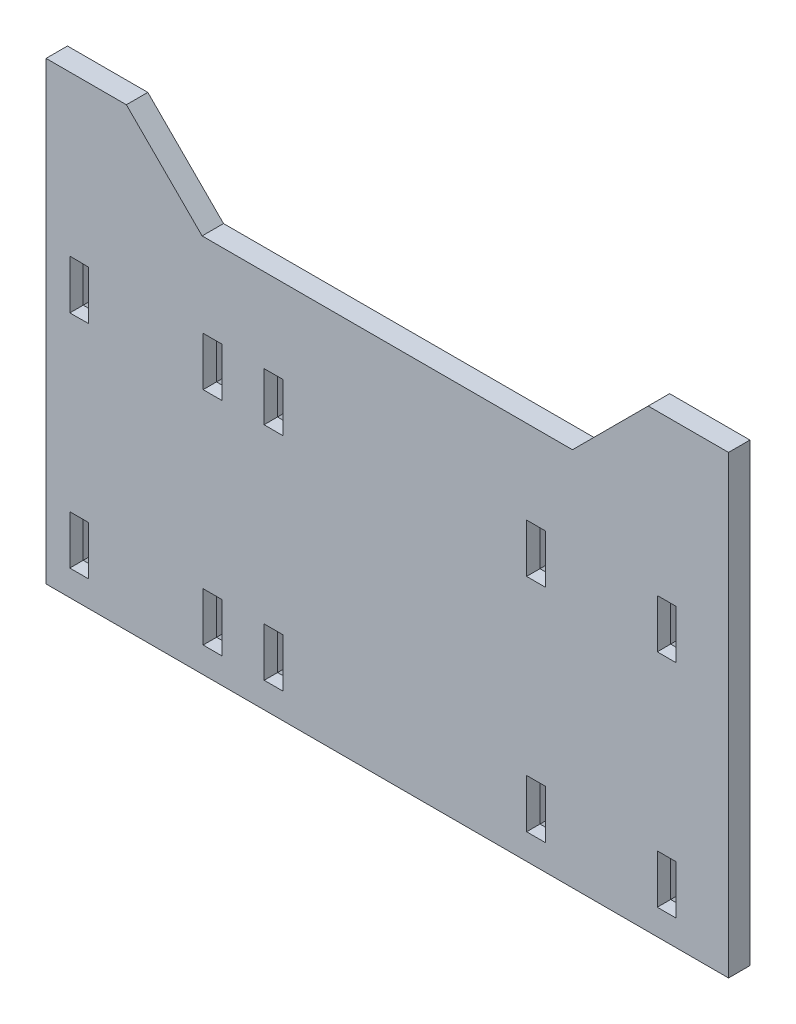
from build123d import *
from OCP.BRepFilletAPI import BRepFilletAPI_MakeChamfer

# Parameters (mm, degrees)
SKETCH1_W           = 127.440194606
SKETCH1_H           = 60
SKETCH1_W_2         = 3.53
SKETCH1_H_2         = 9.11399265
BOSS_EXTRUDE1_DEPTH = 4
BOSS_EXTRUDE2_DEPTH = 4
CHAMFER1_SIZE       = 1.5
CHAMFER1_SIZE2      = 0.5


with BuildPart() as part:
    # Sketch1 → Boss-Extrude1 (new body)
    with BuildSketch(Plane.XY):
        Rectangle(SKETCH1_W, SKETCH1_H)
        with Locations((-32.620097303, 20.65)):
            Rectangle(SKETCH1_W_2, SKETCH1_H_2, mode=Mode.SUBTRACT)
        with Locations((27.7799027, 20.65)):
            Rectangle(SKETCH1_W_2, SKETCH1_H_2, mode=Mode.SUBTRACT)
        with Locations((27.7799027, -20.65)):
            Rectangle(SKETCH1_W_2, SKETCH1_H_2, mode=Mode.SUBTRACT)
        Polygon((-19.455133439, 25.206990566), (-22.985061166, 25.184401952), (-22.999551776, 16.115598048), (-19.440642829, 16.093009434), align=None, mode=Mode.SUBTRACT)
        with Locations((-21.220097303, -20.65)):
            Rectangle(SKETCH1_W_2, SKETCH1_H_2, mode=Mode.SUBTRACT)
        with Locations((52.1799027, 20.65)):
            Rectangle(SKETCH1_W_2, SKETCH1_H_2, mode=Mode.SUBTRACT)
        with Locations((52.1799027, -20.65)):
            Rectangle(SKETCH1_W_2, SKETCH1_H_2, mode=Mode.SUBTRACT)
        with Locations((-32.620097303, -20.65)):
            Rectangle(SKETCH1_W_2, SKETCH1_H_2, mode=Mode.SUBTRACT)
        Polygon((-59.284966326, 25.25), (-55.755228279, 25.206996325), (-55.755228279, 16.093003675), (-59.284966326, 16.05), align=None, mode=Mode.SUBTRACT)
        with Locations((-57.520097303, -20.65)):
            Rectangle(SKETCH1_W_2, SKETCH1_H_2, mode=Mode.SUBTRACT)
    extrude(amount=-BOSS_EXTRUDE1_DEPTH)

    # Sketch2 → Boss-Extrude2 (add)
    with BuildSketch(Plane.XY):
        Polygon((-63.720097303, 30), (-63.720097303, 55), (-48.720097303, 55), (-34.577961679, 40.857864376), (34.577961679, 40.857864376), (48.720097303, 55), (63.720097303, 55), (63.720097303, 30), align=None)
    extrude(amount=-BOSS_EXTRUDE2_DEPTH)

    # Chamfer1: one chamfer whose edges measure the first distance from different faces: ONE call of the kernel's chamfer builder (chamfer() names one face for all edges)
    chamfer1_edges_1 = [part.edges().sort_by_distance(p)[0] for p in [
        (27.7799027, 16.093003675, -4),
    ]]
    chamfer1_side_1 = [part.faces().sort_by_distance(p)[0] for p in [
        (27.7799027, 16.093003675, -2),
    ]]
    chamfer1_edges_2 = [part.edges().sort_by_distance(p)[0] for p in [
        (29.5449027, 20.65, -4),
    ]]
    chamfer1_side_2 = [part.faces().sort_by_distance(p)[0] for p in [
        (29.5449027, 20.65, -2),
    ]]
    chamfer1_edges_3 = [part.edges().sort_by_distance(p)[0] for p in [
        (26.0149027, 20.65, -4),
    ]]
    chamfer1_side_3 = [part.faces().sort_by_distance(p)[0] for p in [
        (26.0149027, 20.65, -2),
    ]]
    chamfer1_edges_4 = [part.edges().sort_by_distance(p)[0] for p in [
        (27.7799027, 25.206996325, -4),
    ]]
    chamfer1_side_4 = [part.faces().sort_by_distance(p)[0] for p in [
        (27.7799027, 25.206996325, -2),
    ]]
    chamfer1_edges_5 = [part.edges().sort_by_distance(p)[0] for p in [
        (53.9449027, 20.65, -4),
    ]]
    chamfer1_side_5 = [part.faces().sort_by_distance(p)[0] for p in [
        (53.9449027, 20.65, -2),
    ]]
    chamfer1_edges_6 = [part.edges().sort_by_distance(p)[0] for p in [
        (52.1799027, 16.093003675, -4),
    ]]
    chamfer1_side_6 = [part.faces().sort_by_distance(p)[0] for p in [
        (52.1799027, 16.093003675, -2),
    ]]
    chamfer1_edges_7 = [part.edges().sort_by_distance(p)[0] for p in [
        (50.4149027, 20.65, -4),
    ]]
    chamfer1_side_7 = [part.faces().sort_by_distance(p)[0] for p in [
        (50.4149027, 20.65, -2),
    ]]
    chamfer1_edges_8 = [part.edges().sort_by_distance(p)[0] for p in [
        (52.1799027, 25.206996325, -4),
    ]]
    chamfer1_side_8 = [part.faces().sort_by_distance(p)[0] for p in [
        (52.1799027, 25.206996325, -2),
    ]]
    chamfer1_edges_9 = [part.edges().sort_by_distance(p)[0] for p in [
        (52.1799027, -25.206996325, -4),
    ]]
    chamfer1_side_9 = [part.faces().sort_by_distance(p)[0] for p in [
        (52.1799027, -25.206996325, -2),
    ]]
    chamfer1_edges_10 = [part.edges().sort_by_distance(p)[0] for p in [
        (53.9449027, -20.65, -4),
    ]]
    chamfer1_side_10 = [part.faces().sort_by_distance(p)[0] for p in [
        (53.9449027, -20.65, -2),
    ]]
    chamfer1_edges_11 = [part.edges().sort_by_distance(p)[0] for p in [
        (52.1799027, -16.093003675, -4),
    ]]
    chamfer1_side_11 = [part.faces().sort_by_distance(p)[0] for p in [
        (52.1799027, -16.093003675, -2),
    ]]
    chamfer1_edges_12 = [part.edges().sort_by_distance(p)[0] for p in [
        (50.4149027, -20.65, -4),
    ]]
    chamfer1_side_12 = [part.faces().sort_by_distance(p)[0] for p in [
        (50.4149027, -20.65, -2),
    ]]
    chamfer1_edges_13 = [part.edges().sort_by_distance(p)[0] for p in [
        (29.5449027, -20.65, -4),
    ]]
    chamfer1_side_13 = [part.faces().sort_by_distance(p)[0] for p in [
        (29.5449027, -20.65, -2),
    ]]
    chamfer1_edges_14 = [part.edges().sort_by_distance(p)[0] for p in [
        (27.7799027, -25.206996325, -4),
    ]]
    chamfer1_side_14 = [part.faces().sort_by_distance(p)[0] for p in [
        (27.7799027, -25.206996325, -2),
    ]]
    chamfer1_edges_15 = [part.edges().sort_by_distance(p)[0] for p in [
        (26.0149027, -20.65, -4),
    ]]
    chamfer1_side_15 = [part.faces().sort_by_distance(p)[0] for p in [
        (26.0149027, -20.65, -2),
    ]]
    chamfer1_edges_16 = [part.edges().sort_by_distance(p)[0] for p in [
        (27.7799027, -16.093003675, -4),
    ]]
    chamfer1_side_16 = [part.faces().sort_by_distance(p)[0] for p in [
        (27.7799027, -16.093003675, -2),
    ]]
    chamfer1_edges_17 = [part.edges().sort_by_distance(p)[0] for p in [
        (-21.220097303, -25.206996325, -4),
    ]]
    chamfer1_side_17 = [part.faces().sort_by_distance(p)[0] for p in [
        (-21.220097303, -25.206996325, -2),
    ]]
    chamfer1_edges_18 = [part.edges().sort_by_distance(p)[0] for p in [
        (-19.455097303, -20.65, -4),
    ]]
    chamfer1_side_18 = [part.faces().sort_by_distance(p)[0] for p in [
        (-19.455097303, -20.65, -2),
    ]]
    chamfer1_edges_19 = [part.edges().sort_by_distance(p)[0] for p in [
        (-21.220097303, -16.093003675, -4),
    ]]
    chamfer1_side_19 = [part.faces().sort_by_distance(p)[0] for p in [
        (-21.220097303, -16.093003675, -2),
    ]]
    chamfer1_edges_20 = [part.edges().sort_by_distance(p)[0] for p in [
        (-22.985097303, -20.65, -4),
    ]]
    chamfer1_side_20 = [part.faces().sort_by_distance(p)[0] for p in [
        (-22.985097303, -20.65, -2),
    ]]
    chamfer1_edges_21 = [part.edges().sort_by_distance(p)[0] for p in [
        (-30.855097303, -20.65, -4),
    ]]
    chamfer1_side_21 = [part.faces().sort_by_distance(p)[0] for p in [
        (-30.855097303, -20.65, -2),
    ]]
    chamfer1_edges_22 = [part.edges().sort_by_distance(p)[0] for p in [
        (-32.620097303, -25.206996325, -4),
    ]]
    chamfer1_side_22 = [part.faces().sort_by_distance(p)[0] for p in [
        (-32.620097303, -25.206996325, -2),
    ]]
    chamfer1_edges_23 = [part.edges().sort_by_distance(p)[0] for p in [
        (-34.385097303, -20.65, -4),
    ]]
    chamfer1_side_23 = [part.faces().sort_by_distance(p)[0] for p in [
        (-34.385097303, -20.65, -2),
    ]]
    chamfer1_edges_24 = [part.edges().sort_by_distance(p)[0] for p in [
        (-32.620097303, -16.093003675, -4),
    ]]
    chamfer1_side_24 = [part.faces().sort_by_distance(p)[0] for p in [
        (-32.620097303, -16.093003675, -2),
    ]]
    chamfer1_edges_25 = [part.edges().sort_by_distance(p)[0] for p in [
        (-55.755097303, -20.65, -4),
    ]]
    chamfer1_side_25 = [part.faces().sort_by_distance(p)[0] for p in [
        (-55.755097303, -20.65, -2),
    ]]
    chamfer1_edges_26 = [part.edges().sort_by_distance(p)[0] for p in [
        (-57.520097303, -16.093003675, -4),
    ]]
    chamfer1_side_26 = [part.faces().sort_by_distance(p)[0] for p in [
        (-57.520097303, -16.093003675, -2),
    ]]
    chamfer1_edges_27 = [part.edges().sort_by_distance(p)[0] for p in [
        (-59.285097303, -20.65, -4),
    ]]
    chamfer1_side_27 = [part.faces().sort_by_distance(p)[0] for p in [
        (-59.285097303, -20.65, -2),
    ]]
    chamfer1_edges_28 = [part.edges().sort_by_distance(p)[0] for p in [
        (-57.520097303, -25.206996325, -4),
    ]]
    chamfer1_side_28 = [part.faces().sort_by_distance(p)[0] for p in [
        (-57.520097303, -25.206996325, -2),
    ]]
    chamfer1_edges_29 = [part.edges().sort_by_distance(p)[0] for p in [
        (-21.220097303, 25.195696259, -4),
    ]]
    chamfer1_side_29 = [part.faces().sort_by_distance(p)[0] for p in [
        (-21.220097303, 25.195696259, -2),
    ]]
    chamfer1_edges_30 = [part.edges().sort_by_distance(p)[0] for p in [
        (-19.447888134, 20.65, -4),
    ]]
    chamfer1_side_30 = [part.faces().sort_by_distance(p)[0] for p in [
        (-19.447888134, 20.65, -2),
    ]]
    chamfer1_edges_31 = [part.edges().sort_by_distance(p)[0] for p in [
        (-21.220097303, 16.104303741, -4),
    ]]
    chamfer1_side_31 = [part.faces().sort_by_distance(p)[0] for p in [
        (-21.220097303, 16.104303741, -2),
    ]]
    chamfer1_edges_32 = [part.edges().sort_by_distance(p)[0] for p in [
        (-22.992306471, 20.65, -4),
    ]]
    chamfer1_side_32 = [part.faces().sort_by_distance(p)[0] for p in [
        (-22.992306471, 20.65, -2),
    ]]
    chamfer1_edges_33 = [part.edges().sort_by_distance(p)[0] for p in [
        (-32.620097303, 16.093003675, -4),
    ]]
    chamfer1_side_33 = [part.faces().sort_by_distance(p)[0] for p in [
        (-32.620097303, 16.093003675, -2),
    ]]
    chamfer1_edges_34 = [part.edges().sort_by_distance(p)[0] for p in [
        (-30.855097303, 20.65, -4),
    ]]
    chamfer1_side_34 = [part.faces().sort_by_distance(p)[0] for p in [
        (-30.855097303, 20.65, -2),
    ]]
    chamfer1_edges_35 = [part.edges().sort_by_distance(p)[0] for p in [
        (-32.620097303, 25.206996325, -4),
    ]]
    chamfer1_side_35 = [part.faces().sort_by_distance(p)[0] for p in [
        (-32.620097303, 25.206996325, -2),
    ]]
    chamfer1_edges_36 = [part.edges().sort_by_distance(p)[0] for p in [
        (-34.385097303, 20.65, -4),
    ]]
    chamfer1_side_36 = [part.faces().sort_by_distance(p)[0] for p in [
        (-34.385097303, 20.65, -2),
    ]]
    chamfer1_edges_37 = [part.edges().sort_by_distance(p)[0] for p in [
        (-57.520097303, 16.071501837, -4),
    ]]
    chamfer1_side_37 = [part.faces().sort_by_distance(p)[0] for p in [
        (-57.520097303, 16.071501837, -2),
    ]]
    chamfer1_edges_38 = [part.edges().sort_by_distance(p)[0] for p in [
        (-55.755228279, 20.65, -4),
    ]]
    chamfer1_side_38 = [part.faces().sort_by_distance(p)[0] for p in [
        (-55.755228279, 20.65, -2),
    ]]
    chamfer1_edges_39 = [part.edges().sort_by_distance(p)[0] for p in [
        (-57.520097303, 25.228498163, -4),
    ]]
    chamfer1_side_39 = [part.faces().sort_by_distance(p)[0] for p in [
        (-57.520097303, 25.228498163, -2),
    ]]
    chamfer1_edges_40 = [part.edges().sort_by_distance(p)[0] for p in [
        (-59.284966326, 20.65, -4),
    ]]
    chamfer1_side_40 = [part.faces().sort_by_distance(p)[0] for p in [
        (-59.284966326, 20.65, -2),
    ]]
    chamfer1 = BRepFilletAPI_MakeChamfer(part.part.solid().wrapped)
    for e in chamfer1_edges_1:
        chamfer1.Add(CHAMFER1_SIZE, CHAMFER1_SIZE2, e.wrapped, chamfer1_side_1[0].wrapped)  # the first distance lies on this face
    for e in chamfer1_edges_2:
        chamfer1.Add(CHAMFER1_SIZE, CHAMFER1_SIZE2, e.wrapped, chamfer1_side_2[0].wrapped)  # the first distance lies on this face
    for e in chamfer1_edges_3:
        chamfer1.Add(CHAMFER1_SIZE, CHAMFER1_SIZE2, e.wrapped, chamfer1_side_3[0].wrapped)  # the first distance lies on this face
    for e in chamfer1_edges_4:
        chamfer1.Add(CHAMFER1_SIZE, CHAMFER1_SIZE2, e.wrapped, chamfer1_side_4[0].wrapped)  # the first distance lies on this face
    for e in chamfer1_edges_5:
        chamfer1.Add(CHAMFER1_SIZE, CHAMFER1_SIZE2, e.wrapped, chamfer1_side_5[0].wrapped)  # the first distance lies on this face
    for e in chamfer1_edges_6:
        chamfer1.Add(CHAMFER1_SIZE, CHAMFER1_SIZE2, e.wrapped, chamfer1_side_6[0].wrapped)  # the first distance lies on this face
    for e in chamfer1_edges_7:
        chamfer1.Add(CHAMFER1_SIZE, CHAMFER1_SIZE2, e.wrapped, chamfer1_side_7[0].wrapped)  # the first distance lies on this face
    for e in chamfer1_edges_8:
        chamfer1.Add(CHAMFER1_SIZE, CHAMFER1_SIZE2, e.wrapped, chamfer1_side_8[0].wrapped)  # the first distance lies on this face
    for e in chamfer1_edges_9:
        chamfer1.Add(CHAMFER1_SIZE, CHAMFER1_SIZE2, e.wrapped, chamfer1_side_9[0].wrapped)  # the first distance lies on this face
    for e in chamfer1_edges_10:
        chamfer1.Add(CHAMFER1_SIZE, CHAMFER1_SIZE2, e.wrapped, chamfer1_side_10[0].wrapped)  # the first distance lies on this face
    for e in chamfer1_edges_11:
        chamfer1.Add(CHAMFER1_SIZE, CHAMFER1_SIZE2, e.wrapped, chamfer1_side_11[0].wrapped)  # the first distance lies on this face
    for e in chamfer1_edges_12:
        chamfer1.Add(CHAMFER1_SIZE, CHAMFER1_SIZE2, e.wrapped, chamfer1_side_12[0].wrapped)  # the first distance lies on this face
    for e in chamfer1_edges_13:
        chamfer1.Add(CHAMFER1_SIZE, CHAMFER1_SIZE2, e.wrapped, chamfer1_side_13[0].wrapped)  # the first distance lies on this face
    for e in chamfer1_edges_14:
        chamfer1.Add(CHAMFER1_SIZE, CHAMFER1_SIZE2, e.wrapped, chamfer1_side_14[0].wrapped)  # the first distance lies on this face
    for e in chamfer1_edges_15:
        chamfer1.Add(CHAMFER1_SIZE, CHAMFER1_SIZE2, e.wrapped, chamfer1_side_15[0].wrapped)  # the first distance lies on this face
    for e in chamfer1_edges_16:
        chamfer1.Add(CHAMFER1_SIZE, CHAMFER1_SIZE2, e.wrapped, chamfer1_side_16[0].wrapped)  # the first distance lies on this face
    for e in chamfer1_edges_17:
        chamfer1.Add(CHAMFER1_SIZE, CHAMFER1_SIZE2, e.wrapped, chamfer1_side_17[0].wrapped)  # the first distance lies on this face
    for e in chamfer1_edges_18:
        chamfer1.Add(CHAMFER1_SIZE, CHAMFER1_SIZE2, e.wrapped, chamfer1_side_18[0].wrapped)  # the first distance lies on this face
    for e in chamfer1_edges_19:
        chamfer1.Add(CHAMFER1_SIZE, CHAMFER1_SIZE2, e.wrapped, chamfer1_side_19[0].wrapped)  # the first distance lies on this face
    for e in chamfer1_edges_20:
        chamfer1.Add(CHAMFER1_SIZE, CHAMFER1_SIZE2, e.wrapped, chamfer1_side_20[0].wrapped)  # the first distance lies on this face
    for e in chamfer1_edges_21:
        chamfer1.Add(CHAMFER1_SIZE, CHAMFER1_SIZE2, e.wrapped, chamfer1_side_21[0].wrapped)  # the first distance lies on this face
    for e in chamfer1_edges_22:
        chamfer1.Add(CHAMFER1_SIZE, CHAMFER1_SIZE2, e.wrapped, chamfer1_side_22[0].wrapped)  # the first distance lies on this face
    for e in chamfer1_edges_23:
        chamfer1.Add(CHAMFER1_SIZE, CHAMFER1_SIZE2, e.wrapped, chamfer1_side_23[0].wrapped)  # the first distance lies on this face
    for e in chamfer1_edges_24:
        chamfer1.Add(CHAMFER1_SIZE, CHAMFER1_SIZE2, e.wrapped, chamfer1_side_24[0].wrapped)  # the first distance lies on this face
    for e in chamfer1_edges_25:
        chamfer1.Add(CHAMFER1_SIZE, CHAMFER1_SIZE2, e.wrapped, chamfer1_side_25[0].wrapped)  # the first distance lies on this face
    for e in chamfer1_edges_26:
        chamfer1.Add(CHAMFER1_SIZE, CHAMFER1_SIZE2, e.wrapped, chamfer1_side_26[0].wrapped)  # the first distance lies on this face
    for e in chamfer1_edges_27:
        chamfer1.Add(CHAMFER1_SIZE, CHAMFER1_SIZE2, e.wrapped, chamfer1_side_27[0].wrapped)  # the first distance lies on this face
    for e in chamfer1_edges_28:
        chamfer1.Add(CHAMFER1_SIZE, CHAMFER1_SIZE2, e.wrapped, chamfer1_side_28[0].wrapped)  # the first distance lies on this face
    for e in chamfer1_edges_29:
        chamfer1.Add(CHAMFER1_SIZE, CHAMFER1_SIZE2, e.wrapped, chamfer1_side_29[0].wrapped)  # the first distance lies on this face
    for e in chamfer1_edges_30:
        chamfer1.Add(CHAMFER1_SIZE, CHAMFER1_SIZE2, e.wrapped, chamfer1_side_30[0].wrapped)  # the first distance lies on this face
    for e in chamfer1_edges_31:
        chamfer1.Add(CHAMFER1_SIZE, CHAMFER1_SIZE2, e.wrapped, chamfer1_side_31[0].wrapped)  # the first distance lies on this face
    for e in chamfer1_edges_32:
        chamfer1.Add(CHAMFER1_SIZE, CHAMFER1_SIZE2, e.wrapped, chamfer1_side_32[0].wrapped)  # the first distance lies on this face
    for e in chamfer1_edges_33:
        chamfer1.Add(CHAMFER1_SIZE, CHAMFER1_SIZE2, e.wrapped, chamfer1_side_33[0].wrapped)  # the first distance lies on this face
    for e in chamfer1_edges_34:
        chamfer1.Add(CHAMFER1_SIZE, CHAMFER1_SIZE2, e.wrapped, chamfer1_side_34[0].wrapped)  # the first distance lies on this face
    for e in chamfer1_edges_35:
        chamfer1.Add(CHAMFER1_SIZE, CHAMFER1_SIZE2, e.wrapped, chamfer1_side_35[0].wrapped)  # the first distance lies on this face
    for e in chamfer1_edges_36:
        chamfer1.Add(CHAMFER1_SIZE, CHAMFER1_SIZE2, e.wrapped, chamfer1_side_36[0].wrapped)  # the first distance lies on this face
    for e in chamfer1_edges_37:
        chamfer1.Add(CHAMFER1_SIZE, CHAMFER1_SIZE2, e.wrapped, chamfer1_side_37[0].wrapped)  # the first distance lies on this face
    for e in chamfer1_edges_38:
        chamfer1.Add(CHAMFER1_SIZE, CHAMFER1_SIZE2, e.wrapped, chamfer1_side_38[0].wrapped)  # the first distance lies on this face
    for e in chamfer1_edges_39:
        chamfer1.Add(CHAMFER1_SIZE, CHAMFER1_SIZE2, e.wrapped, chamfer1_side_39[0].wrapped)  # the first distance lies on this face
    for e in chamfer1_edges_40:
        chamfer1.Add(CHAMFER1_SIZE, CHAMFER1_SIZE2, e.wrapped, chamfer1_side_40[0].wrapped)  # the first distance lies on this face
    add(Compound.cast(chamfer1.Shape()), mode=Mode.REPLACE)


solid = part.part
